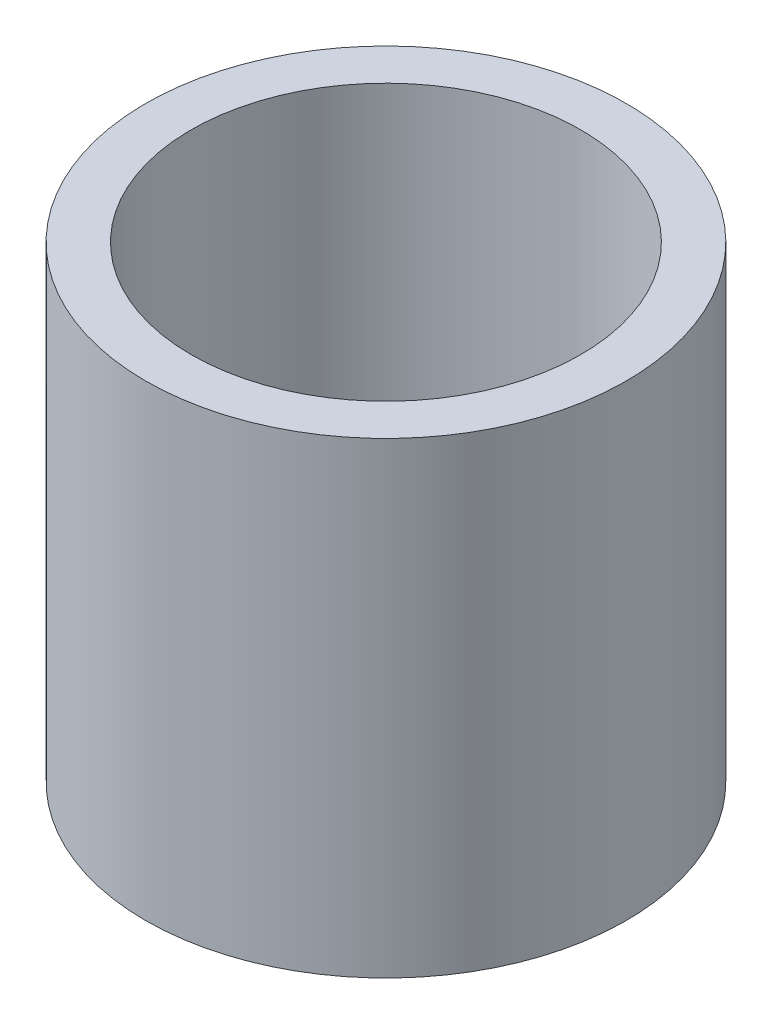
from build123d import *

# Parameters (mm, degrees)
SKETCH1_R           = 52.5
BOSS_EXTRUDE1_DEPTH = 102.084634011
SKETCH2_R           = 42.55238534
CUT_EXTRUDE1_DEPTH  = 127.229047771


with BuildPart() as part:
    # Sketch1 → Boss-Extrude1 (new body)
    with BuildSketch(Plane(origin=(0, 0, 0), x_dir=(1, 0, 0), z_dir=(0, 1, 0))):
        Circle(SKETCH1_R)
    extrude(amount=BOSS_EXTRUDE1_DEPTH)

    # Sketch2 → Cut-Extrude1 (cut, through all)
    with BuildSketch(Plane(origin=(0, 0, 0), x_dir=(1, 0, 0), z_dir=(0, 1, 0))):
        Circle(SKETCH2_R)
    extrude(amount=CUT_EXTRUDE1_DEPTH, mode=Mode.SUBTRACT)


solid = part.part
